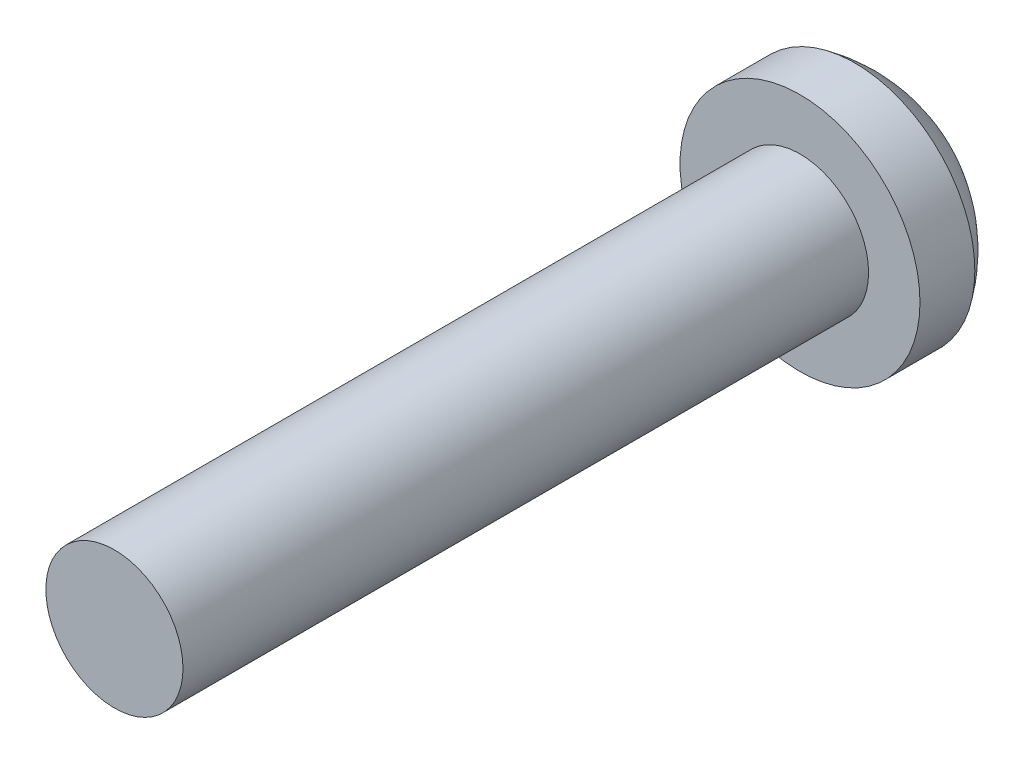
from build123d import *

# Parameters (mm, degrees)
CUT_EXTRUDE1_DEPTH = 0.5


with BuildPart() as part:
    # Sketch1 → Revolve1 (revolve)
    with BuildSketch(Plane(origin=(0, 0, 0), x_dir=(1, 0, 0), z_dir=(0, 1, 0))):
        with BuildLine():
            Line((0, 0), (1, 0))
            Line((1, 0), (1, 10))
            Line((1, 10), (1.75, 10))
            Line((1.75, 10), (1.75, 10.8))
            ThreePointArc((1.75, 10.8), (0.98674839, 11.470494184), (0, 11.712244233))
            Line((0, 11.712244233), (0, 0))
        make_face()
    revolve(axis=Axis((0, 0, 117.233112438), (0, 0, -1)))

    # Sketch2 → Cut-Extrude1 (cut, symmetric)
    with BuildSketch(Plane.XY.offset(-11.7)):
        with BuildLine():
            Line((-0.25, 1.187996553), (-0.25, 0.25))
            Line((-0.25, 0.25), (-1.187996553, 0.25))
            ThreePointArc((-1.187996553, 0.25), (-1.214016396, 0), (-1.187996553, -0.25))
            Line((-1.187996553, -0.25), (-0.25, -0.25))
            Line((-0.25, -0.25), (-0.25, -1.187996553))
            ThreePointArc((-0.25, -1.187996553), (0, -1.214016396), (0.25, -1.187996553))
            Line((0.25, -1.187996553), (0.25, -0.25))
            Line((0.25, -0.25), (1.187996553, -0.25))
            ThreePointArc((1.187996553, -0.25), (1.214016396, 0), (1.187996553, 0.25))
            Line((1.187996553, 0.25), (0.25, 0.25))
            Line((0.25, 0.25), (0.25, 1.187996553))
            ThreePointArc((0.25, 1.187996553), (0, 1.214016396), (-0.25, 1.187996553))
        make_face()
    extrude(amount=CUT_EXTRUDE1_DEPTH, both=True, mode=Mode.SUBTRACT)


solid = part.part
